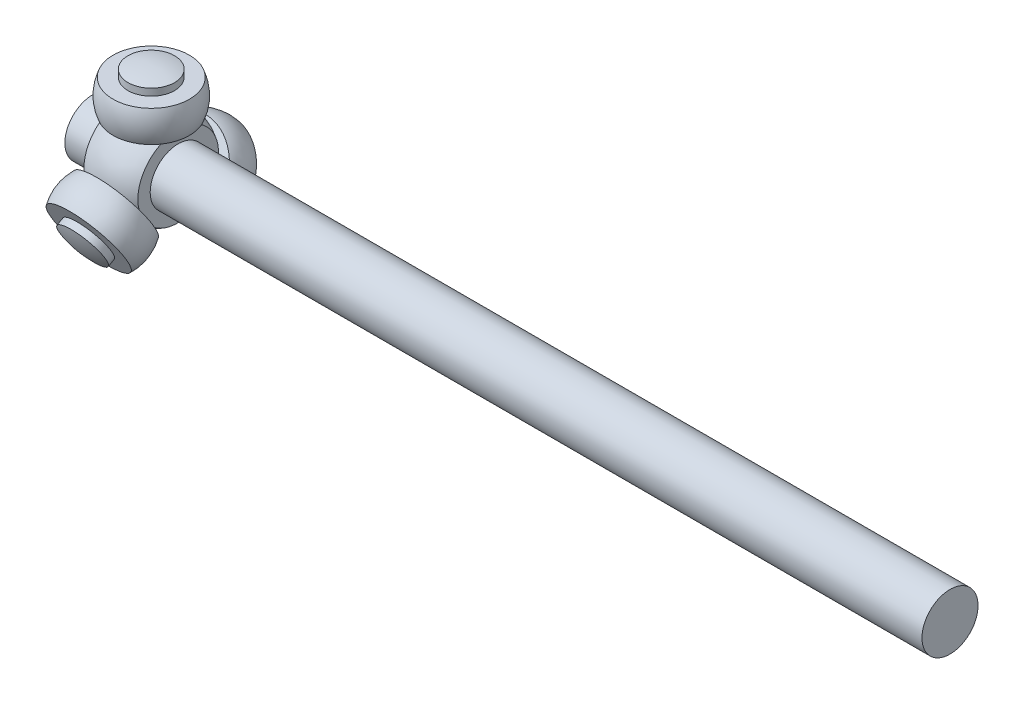
from build123d import *

# Parameters (mm, degrees)
CUT_EXTRUDE1_DEPTH       = 29.014947405
BOSS_EXTRUDE1_START      = 13.11
BOSS_EXTRUDE1_OUTLINE_R  = 7.478502705
BOSS_EXTRUDE1_DEPTH      = 10.08
CIRPATTERN1_COUNT        = 3
BOSS_EXTRUDE2_DEPTH      = 10.08
BOSS_EXTRUDE2_DEPTH_BACK = 265
SKETCH6_R                = 9


# Read off the part's stored shape, not the designer's step: Boss-Extrude1, Revolve3
with BuildPart() as part:
    # Sketch1 → Revolve1 (revolve)
    with BuildSketch(Plane.XY):
        with BuildLine():
            Line((-8.653846154, 12.951890954), (-8.653846154, 9))
            Line((-8.653846154, 9), (8.653846154, 9))
            Line((8.653846154, 9), (8.653846154, 12.951890954))
            ThreePointArc((8.653846154, 12.951890954), (0, 15.576923077), (-8.653846154, 12.951890954))
        make_face()
    revolve(axis=Axis((-47.061566383, 0, 0), (1, 0, 0)))

    # Sketch2 → Cut-Extrude1 (cut, symmetric)
    with BuildSketch(Plane(origin=(8.653846154, 0, 0), x_dir=(0, 0, -1), z_dir=(1, 0, 0))):
        Polygon((-17.183661108, 13.11), (20.1337897, 13.11), (18.772985043, 23.764289573), (-17.183661108, 23.764289573), align=None)
    cut_extrude1 = extrude(amount=CUT_EXTRUDE1_DEPTH, both=True, mode=Mode.SUBTRACT)

    # Boss-Extrude1 outline → Boss-Extrude1 (add)
    with BuildSketch(Plane(origin=(0, 0, 0), x_dir=(1, 0, 0), z_dir=(0, 1, 0)).offset(BOSS_EXTRUDE1_START)):
        Circle(BOSS_EXTRUDE1_OUTLINE_R)
    boss_extrude1 = extrude(amount=BOSS_EXTRUDE1_DEPTH)

    # Sketch4 → Revolve2 (revolve)
    with BuildSketch(Plane(origin=(0, 0, 0), x_dir=(0, 0, -1), z_dir=(1, 0, 0)), mode=Mode.PRIVATE) as revolve2_sk:
        with BuildLine():
            Line((7.478502705, 25.422863672), (7.478502705, 23.19))
            Line((7.478502705, 23.19), (0, 23.19))
            Line((0, 23.19), (0, 26.5))
            ThreePointArc((0, 26.5), (3.777837522, 26.229333649), (7.478502705, 25.422863672))
        make_face()
    revolve2 = revolve(revolve2_sk.sketch.rotate(Axis((0, 0, 0), (0, 1, 0)), 180), axis=Axis((0, 0, 0), (0, 1, 0)))

    # Revolve3 outline → Revolve3 (revolve)
    with BuildSketch(Plane.XY):
        with BuildLine():
            Line((7.478502705, 13.109999994), (12.254015665, 13.109999994))
            ThreePointArc((12.254015665, 13.109999994), (13.25, 18.15), (12.254015665, 23.190000006))
            Line((12.254015665, 23.190000006), (7.478502705, 23.19))
            Line((7.478502705, 23.19), (7.478502705, 13.109999994))
        make_face()
    revolve3 = revolve(axis=Axis((0, 0, 0), (0, 1, 0)))

    # CirPattern1: Cut-Extrude1, Boss-Extrude1, Revolve2, Revolve3 ×3 about axis
    cirpattern1_axis = Axis((0, 0, 0), (1, 0, 0))
    add([cut_extrude1.rotate(cirpattern1_axis, i * 360 / CIRPATTERN1_COUNT) for i in range(1, CIRPATTERN1_COUNT)], mode=Mode.SUBTRACT)
    add([boss_extrude1.rotate(cirpattern1_axis, i * 360 / CIRPATTERN1_COUNT) for i in range(1, CIRPATTERN1_COUNT)])
    add([revolve2.rotate(cirpattern1_axis, i * 360 / CIRPATTERN1_COUNT) for i in range(1, CIRPATTERN1_COUNT)])
    add([revolve3.rotate(cirpattern1_axis, i * 360 / CIRPATTERN1_COUNT) for i in range(1, CIRPATTERN1_COUNT)])

    # Sketch6 → Boss-Extrude2 (add, two sides: drawn at the far end of the back side and taken through both)
    with BuildSketch(Plane.ZY.offset(8.653846154).offset(-BOSS_EXTRUDE2_DEPTH_BACK)):
        Circle(SKETCH6_R)
    extrude(amount=BOSS_EXTRUDE2_DEPTH + BOSS_EXTRUDE2_DEPTH_BACK)


solid = part.part
